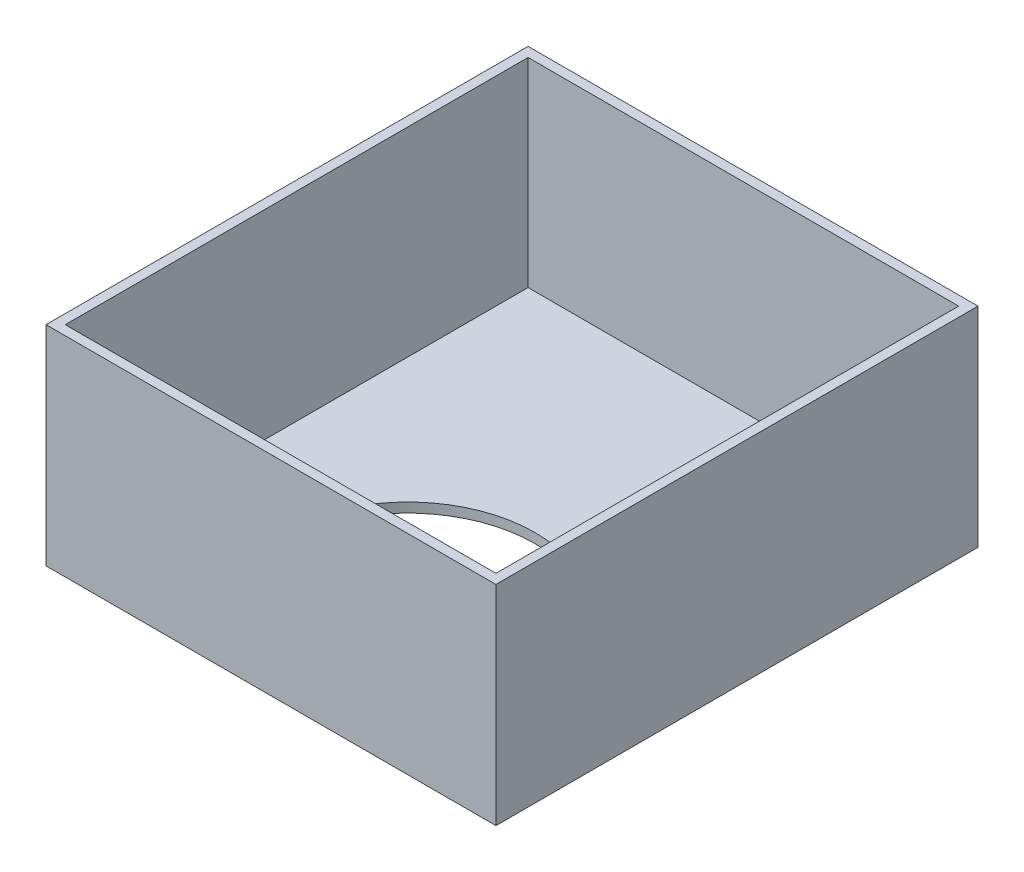
from build123d import *

# Parameters (mm, degrees)
SKETCH1_W           = 90
SKETCH1_H           = 85
BOSS_EXTRUDE1_DEPTH = 3
SKETCH2_R           = 39.5
CUT_EXTRUDE1_DEPTH  = 3
SKETCH3_R           = 1.5
CUT_EXTRUDE2_DEPTH  = 3
SKETCH4_W           = 140
SKETCH4_H           = 150
BOSS_EXTRUDE2_DEPTH = 70
SKETCH5_W           = 134
SKETCH5_H           = 144
CUT_EXTRUDE6_DEPTH  = 67
SKETCH6_R           = 39.5
CUT_EXTRUDE7_DEPTH  = 67
SKETCH7_R           = 1.375
CUT_EXTRUDE8_DEPTH  = 10
SKETCH8_W           = 140
SKETCH8_H           = 150
CUT_EXTRUDE9_DEPTH  = 5


with BuildPart() as part:
    # Sketch1 → Boss-Extrude1 (new body)
    with BuildSketch(Plane(origin=(0, 0, 0), x_dir=(1, 0, 0), z_dir=(0, 1, 0))):
        Rectangle(SKETCH1_W, SKETCH1_H)
    extrude(amount=BOSS_EXTRUDE1_DEPTH)

    # Sketch2 → Cut-Extrude1 (cut)
    with BuildSketch(Plane(origin=(0, 3, 0), x_dir=(1, 0, 0), z_dir=(0, 1, 0))):
        Circle(SKETCH2_R)
    extrude(amount=-CUT_EXTRUDE1_DEPTH, mode=Mode.SUBTRACT)

    # Sketch3 → Cut-Extrude2 (cut)
    with BuildSketch(Plane(origin=(0, 3, 0), x_dir=(1, 0, 0), z_dir=(0, 1, 0))):
        with Locations((-42, 7)):
            Circle(SKETCH3_R)
        with Locations((42, 7)):
            Circle(SKETCH3_R)
        with Locations((42, -7)):
            Circle(SKETCH3_R)
        with Locations((-42, -7)):
            Circle(SKETCH3_R)
    extrude(amount=-CUT_EXTRUDE2_DEPTH, mode=Mode.SUBTRACT)

    # Sketch4 → Boss-Extrude2 (add)
    with BuildSketch(Plane(origin=(0, 0, 0), x_dir=(1, 0, 0), z_dir=(0, 1, 0))):
        with Locations((0, 32.433689159)):
            Rectangle(SKETCH4_W, SKETCH4_H)
    extrude(amount=BOSS_EXTRUDE2_DEPTH)

    # Sketch5 → Cut-Extrude6 (cut)
    with BuildSketch(Plane(origin=(0, 70, 0), x_dir=(1, 0, 0), z_dir=(0, 1, 0))):
        with Locations((0, 32.433689159)):
            Rectangle(SKETCH5_W, SKETCH5_H)
    extrude(amount=-CUT_EXTRUDE6_DEPTH, mode=Mode.SUBTRACT)

    # Sketch6 → Cut-Extrude7 (cut)
    with BuildSketch(Plane.XZ):
        Circle(SKETCH6_R)
    extrude(amount=-CUT_EXTRUDE7_DEPTH, mode=Mode.SUBTRACT)

    # Sketch7 → Cut-Extrude8 (cut)
    with BuildSketch(Plane.XZ):
        with Locations((-42, 10)):
            Circle(SKETCH7_R)
        with Locations((-42, -4)):
            Circle(SKETCH7_R)
        with Locations((42, -4)):
            Circle(SKETCH7_R)
        with Locations((42, 10)):
            Circle(SKETCH7_R)
    extrude(amount=-CUT_EXTRUDE8_DEPTH, mode=Mode.SUBTRACT)

    # Sketch8 → Cut-Extrude9 (cut)
    with BuildSketch(Plane(origin=(0, 70, 0), x_dir=(1, 0, 0), z_dir=(0, 1, 0))):
        with Locations((0, 32.433689159)):
            Rectangle(SKETCH8_W, SKETCH8_H)
    extrude(amount=-CUT_EXTRUDE9_DEPTH, mode=Mode.SUBTRACT)


solid = part.part
